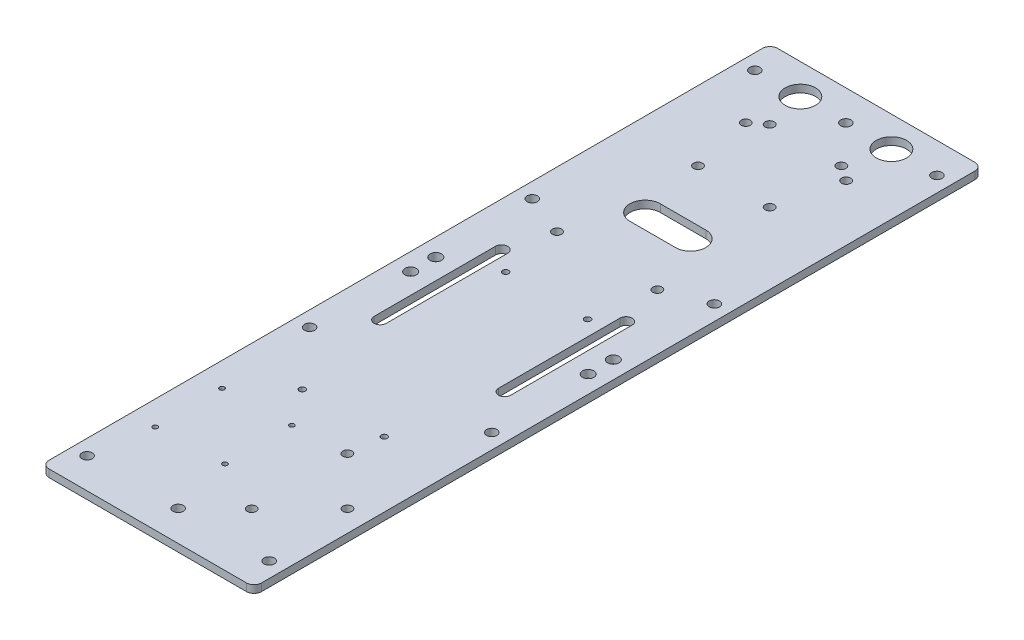
from build123d import *

# Parameters (mm, degrees)
PLATE_THICKNESS_DEPTH        = 3.175
SKETCH3_R                    = 2.159
MOUNTING_HOLES_DEPTH         = 159.781746826
SKETCH4_R                    = 1.905
JETSON_HOLES_W_O_MOUNT_DEPTH = 159.781746826
SKETCH5_R                    = 1.905
PDB_HOLES_DEPTH              = 159.781746826
SKETCH7_R                    = 1.27
PIXHAWK_HOLES_DEPTH          = 159.781746826
BATTERY_HOLES_DEPTH          = 159.781746826
VENTRAL_CAMERA_HOLES_REACH   = 160.782
SKETCH10_R                   = 1
SKETCH12_R                   = 6.35
WIFI_ANTENNA_HOLES_DEPTH     = 159.781746826
SKETCH6_R                    = 1.905
TERARANGER_HOLES_DEPTH       = 159.781746826
SKETCH14_R                   = 2.38125
SONARHOLES_DEPTH             = 159.781746826
CUT_EXTRUDE1_DEPTH           = 159.781746826


with BuildPart() as part:
    # Sketch2 → Plate Thickness (new body)
    with BuildSketch(Plane(origin=(0, 0, 0), x_dir=(1, 0, 0), z_dir=(0, 1, 0))):
        with BuildLine():
            Line((-41.275, 152.4), (41.275, 152.4))
            ThreePointArc((41.275, 152.4), (43.52006403, 151.47006403), (44.45, 149.225))
            Line((44.45, 149.225), (44.45, -149.225))
            ThreePointArc((44.45, -149.225), (43.52006403, -151.47006403), (41.275, -152.4))
            Line((41.275, -152.4), (-41.275, -152.4))
            ThreePointArc((-41.275, -152.4), (-43.52006403, -151.47006403), (-44.45, -149.225))
            Line((-44.45, -149.225), (-44.45, 149.225))
            ThreePointArc((-44.45, 149.225), (-43.52006403, 151.47006403), (-41.275, 152.4))
        make_face()
    extrude(amount=PLATE_THICKNESS_DEPTH)

    # Sketch3 → Mounting holes (cut, through all)
    with BuildSketch(Plane(origin=(0, 3.175, 0), x_dir=(1, 0, 0), z_dir=(0, 1, 0))):
        with Locations((-38.1, 139.7)):
            Circle(SKETCH3_R)
        with Locations((-38.1, 46.566666666)):
            Circle(SKETCH3_R)
        with Locations((-38.1, -46.56666582)):
            Circle(SKETCH3_R)
        with Locations((-38.1, -139.7)):
            Circle(SKETCH3_R)
        with Locations((38.1, -139.7)):
            Circle(SKETCH3_R)
        with Locations((38.1, -46.56666582)):
            Circle(SKETCH3_R)
        with Locations((38.1, 46.566666666)):
            Circle(SKETCH3_R)
        with Locations((38.1, 139.7)):
            Circle(SKETCH3_R)
        with Locations((0, 139.7)):
            Circle(SKETCH3_R)
        with Locations((0, -139.7)):
            Circle(SKETCH3_R)
    extrude(amount=-MOUNTING_HOLES_DEPTH, mode=Mode.SUBTRACT)

    # Sketch4 → Jetson Holes (w/o mount) (cut, through all)
    with BuildSketch(Plane(origin=(0, 3.175, 0), x_dir=(1, 0, 0), z_dir=(0, 1, 0))):
        with Locations((-21.0058, 118.808268359)):
            Circle(SKETCH4_R)
        with Locations((-21.0058, 39.814268359)):
            Circle(SKETCH4_R)
        with Locations((21.0058, 39.814268359)):
            Circle(SKETCH4_R)
        with Locations((21.0058, 118.808268359)):
            Circle(SKETCH4_R)
    extrude(amount=-JETSON_HOLES_W_O_MOUNT_DEPTH, mode=Mode.SUBTRACT)

    # Sketch5 → PDB holes (cut, through all)
    with BuildSketch(Plane(origin=(0, 3.175, 0), x_dir=(1, 0, 0), z_dir=(0, 1, 0))):
        with Locations((-15.378405846, 123.19)):
            Circle(SKETCH5_R)
        with Locations((14.618994154, 123.19)):
            Circle(SKETCH5_R)
        with Locations((14.618994154, 93.1926)):
            Circle(SKETCH5_R)
        with Locations((-15.378405846, 93.1926)):
            Circle(SKETCH5_R)
    extrude(amount=-PDB_HOLES_DEPTH, mode=Mode.SUBTRACT)

    # Sketch7 → PixHawk Holes (cut, through all)
    with BuildSketch(Plane(origin=(0, 3.175, 0), x_dir=(1, 0, 0), z_dir=(0, 1, 0))):
        with Locations((-17.145, 14.489268954)):
            Circle(SKETCH7_R)
        with Locations((-17.145, -70.600731046)):
            Circle(SKETCH7_R)
        with Locations((17.145, -70.600731046)):
            Circle(SKETCH7_R)
        with Locations((17.145, 14.489268954)):
            Circle(SKETCH7_R)
    extrude(amount=-PIXHAWK_HOLES_DEPTH, mode=Mode.SUBTRACT)

    # Sketch8 → Battery Holes (cut, through all)
    with BuildSketch(Plane(origin=(0, 3.175, 0), x_dir=(1, 0, 0), z_dir=(0, 1, 0))):
        with BuildLine():
            Line((-23.495, 21.689654687), (-23.495, -29.110345313))
            ThreePointArc((-23.495, -29.110345313), (-26.035, -31.650345313), (-28.575, -29.110345313))
            Line((-28.575, -29.110345313), (-28.575, 21.689654687))
            ThreePointArc((-28.575, 21.689654687), (-26.035, 24.229654687), (-23.495, 21.689654687))
        make_face()
        with BuildLine():
            Line((23.495, 21.689654687), (23.495, -29.110345313))
            ThreePointArc((23.495, -29.110345313), (26.035, -31.650345313), (28.575, -29.110345313))
            Line((28.575, -29.110345313), (28.575, 21.689654687))
            ThreePointArc((28.575, 21.689654687), (26.035, 24.229654687), (23.495, 21.689654687))
        make_face()
    extrude(amount=-BATTERY_HOLES_DEPTH, mode=Mode.SUBTRACT)

    # Sketch10 → Ventral Camera holes (cut, up to next)
    with BuildSketch(Plane(origin=(0, 3.175, 0), x_dir=(1, 0, 0), z_dir=(0, 1, 0)), mode=Mode.PRIVATE) as ventral_camera_holes_sk1:
        with Locations((-34.315460092, -87.008641581)):
            Circle(SKETCH10_R)
    ventral_camera_holes_tool1 = extrude(ventral_camera_holes_sk1.sketch, amount=-VENTRAL_CAMERA_HOLES_REACH, mode=Mode.PRIVATE) & part.part
    # Sketch10 → Ventral Camera holes (cut, up to next)
    with BuildSketch(Plane(origin=(0, 3.175, 0), x_dir=(1, 0, 0), z_dir=(0, 1, 0)), mode=Mode.PRIVATE) as ventral_camera_holes_sk2:
        with Locations((-34.29, -115.008630005)):
            Circle(SKETCH10_R)
    ventral_camera_holes_tool2 = extrude(ventral_camera_holes_sk2.sketch, amount=-VENTRAL_CAMERA_HOLES_REACH, mode=Mode.PRIVATE) & part.part
    # Sketch10 → Ventral Camera holes (cut, up to next)
    with BuildSketch(Plane(origin=(0, 3.175, 0), x_dir=(1, 0, 0), z_dir=(0, 1, 0)), mode=Mode.PRIVATE) as ventral_camera_holes_sk3:
        with Locations((-6.316568972, -85.789139736)):
            Circle(SKETCH10_R)
    ventral_camera_holes_tool3 = extrude(ventral_camera_holes_sk3.sketch, amount=-VENTRAL_CAMERA_HOLES_REACH, mode=Mode.PRIVATE) & part.part
    # Sketch10 → Ventral Camera holes (cut, up to next)
    with BuildSketch(Plane(origin=(0, 3.175, 0), x_dir=(1, 0, 0), z_dir=(0, 1, 0)), mode=Mode.PRIVATE) as ventral_camera_holes_sk4:
        with Locations((-6.316568972, -113.789139736)):
            Circle(SKETCH10_R)
    ventral_camera_holes_tool4 = extrude(ventral_camera_holes_sk4.sketch, amount=-VENTRAL_CAMERA_HOLES_REACH, mode=Mode.PRIVATE) & part.part
    add(ventral_camera_holes_tool1.solids().sort_by_distance((-34.31546, 3.175, 87.008642))[0], mode=Mode.SUBTRACT)
    add(ventral_camera_holes_tool2.solids().sort_by_distance((-34.29, 3.175, 115.00863))[0], mode=Mode.SUBTRACT)
    add(ventral_camera_holes_tool3.solids().sort_by_distance((-6.316569, 3.175, 85.78914))[0], mode=Mode.SUBTRACT)
    add(ventral_camera_holes_tool4.solids().sort_by_distance((-6.316569, 3.175, 113.78914))[0], mode=Mode.SUBTRACT)

    # Sketch12 → Wifi antenna holes (cut, through all)
    with BuildSketch(Plane(origin=(0, 3.175, 0), x_dir=(1, 0, 0), z_dir=(0, 1, 0))):
        with Locations((-19.05, 139.7)):
            Circle(SKETCH12_R)
        with Locations((19.05, 139.7)):
            Circle(SKETCH12_R)
    extrude(amount=-WIFI_ANTENNA_HOLES_DEPTH, mode=Mode.SUBTRACT)

    # Sketch6 → TeraRanger Holes (cut, through all)
    with BuildSketch(Plane(origin=(0, 3.175, 0), x_dir=(1, 0, 0), z_dir=(0, 1, 0))):
        with Locations((35.56, -104.394)):
            Circle(SKETCH6_R)
        with Locations((15.56, -84.46)):
            Circle(SKETCH6_R)
        with Locations((15.56, -124.46)):
            Circle(SKETCH6_R)
    extrude(amount=-TERARANGER_HOLES_DEPTH, mode=Mode.SUBTRACT)

    # Sketch14 → Sonarholes (cut, through all)
    with BuildSketch(Plane(origin=(0, 3.175, 0), x_dir=(1, 0, 0), z_dir=(0, 1, 0))):
        with Locations((-37.138013211, 5.246249985)):
            Circle(SKETCH14_R)
        with Locations((-37.138013211, -5.246249985)):
            Circle(SKETCH14_R)
        with Locations((37.138013211, -5.246249985)):
            Circle(SKETCH14_R)
        with Locations((37.138013211, 5.246249985)):
            Circle(SKETCH14_R)
    extrude(amount=-SONARHOLES_DEPTH, mode=Mode.SUBTRACT)

    # Sketch15 → Cut-Extrude1 (cut, through all)
    with BuildSketch(Plane(origin=(0, 0, 0), x_dir=(-1, 0, 0), z_dir=(0, -1, 0))):
        with BuildLine():
            Line((-9.525, 71.564268359), (9.525, 71.564268359))
            ThreePointArc((9.525, 71.564268359), (15.875, 65.214268359), (9.525, 58.864268359))
            Line((9.525, 58.864268359), (-9.525, 58.864268359))
            ThreePointArc((-9.525, 58.864268359), (-15.875, 65.214268359), (-9.525, 71.564268359))
        make_face()
    extrude(amount=-CUT_EXTRUDE1_DEPTH, mode=Mode.SUBTRACT)


solid = part.part
